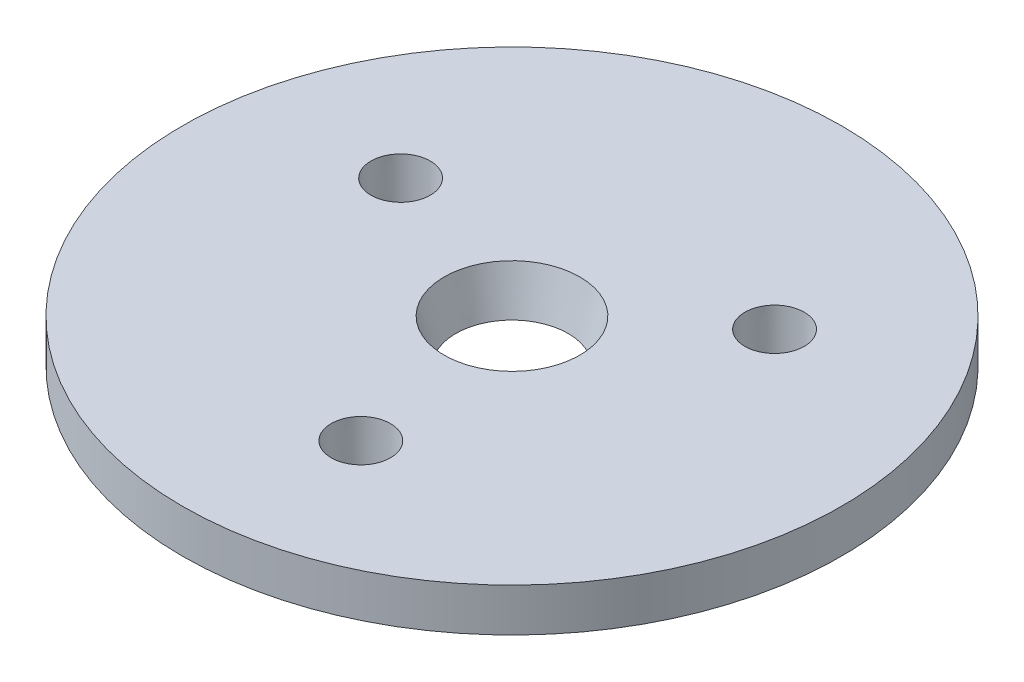
from build123d import *

# Parameters (mm, degrees)
SKETCH1_R           = 76.2
BOSS_EXTRUDE1_DEPTH = 10
CIRPATTERN6_COUNT   = 3


with BuildPart() as part:
    # Sketch1 → Boss-Extrude1 (new body)
    with BuildSketch(Plane(origin=(0, 0, 0), x_dir=(1, 0, 0), z_dir=(0, 1, 0))):
        Circle(SKETCH1_R)
    extrude(amount=BOSS_EXTRUDE1_DEPTH)

    # Sketch5 → Cut-Revolve1 (revolve, cut)
    with BuildSketch(Plane.XY):
        Polygon((0, 0), (0, 10), (15.679491924, 10), (13, 0), align=None)
    revolve(axis=Axis((0, 0, 0), (0, 1, 0)), mode=Mode.SUBTRACT)

    # Sketch15 → 1/4 NPT Tapped Hole1 (revolve, cut)
    with BuildSketch(Plane(origin=(33.011727721, 10, -27.700128555), x_dir=(0, 0, 1), z_dir=(1, 0, 0))):
        Polygon((0, 0), (0, 10), (5.5626, 10), (5.5626, 10.0203), (6.557978799, 10.0203), (6.858, 0), align=None)
    f_1_4_npt_tapped_hole1 = revolve(axis=Axis((33.011727721, 16.35, -27.700128555), (0, -1, 0)), mode=Mode.SUBTRACT)

    # CirPattern6: 1/4 NPT Tapped Hole1 ×3 about axis
    cirpattern6_axis = Axis((0, 10, 0), (0, 1, 0))
    for i in range(1, CIRPATTERN6_COUNT):
        add(f_1_4_npt_tapped_hole1.rotate(cirpattern6_axis, i * 360 / CIRPATTERN6_COUNT), mode=Mode.SUBTRACT)


solid = part.part
